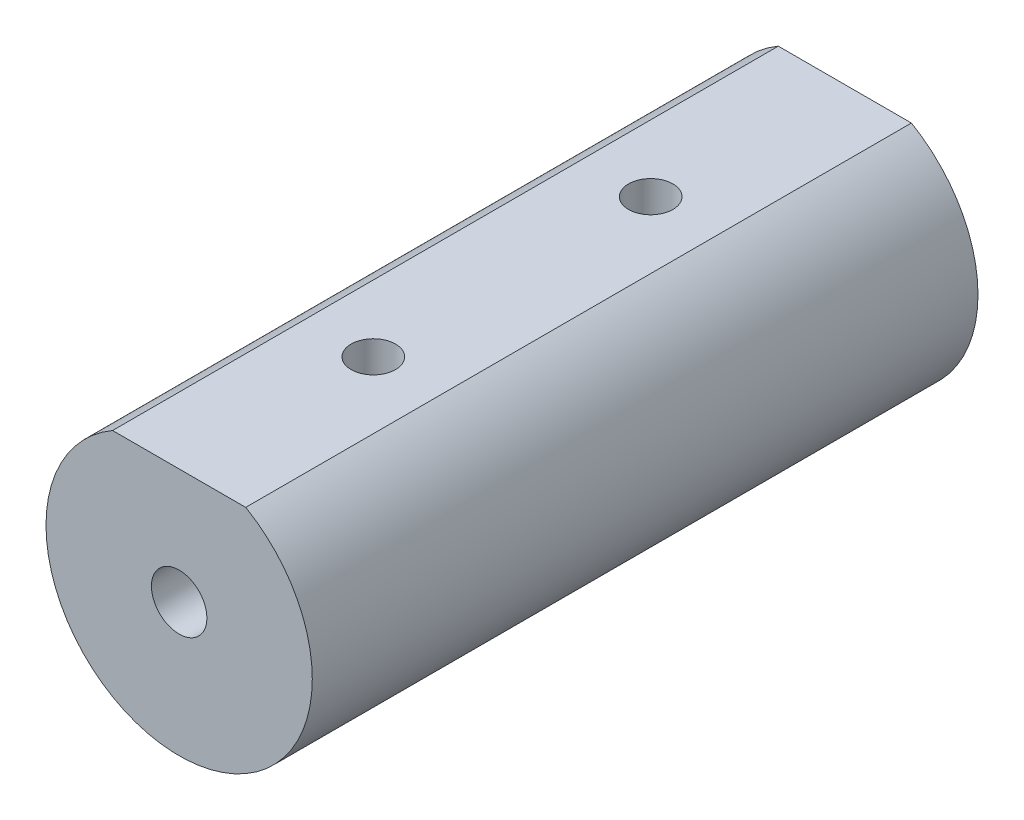
from build123d import *

# Parameters (mm, degrees)
SKETCH1_W          = 60
SKETCH1_H          = 9.5
CUT_EXTRUDE1_REACH = 64.354
CUT_EXTRUDE2_REACH = 67.157
SKETCH3_R          = 2


with BuildPart() as part:
    # Sketch1 → Revolve1 (revolve)
    with BuildSketch(Plane(origin=(0, 0, 0), x_dir=(0, 0, -1), z_dir=(1, 0, 0))):
        with Locations((30, 7.25)):
            Rectangle(SKETCH1_W, SKETCH1_H)
    revolve(axis=Axis((0, 0, 0), (0, 0, -1)))

    # Sketch2 → Cut-Extrude1 (cut, up to next)
    with BuildSketch(Plane(origin=(0, 0, -60), x_dir=(-1, 0, 0), z_dir=(0, 0, -1)), mode=Mode.PRIVATE) as cut_extrude1_sk1:
        with BuildLine():
            Line((6, 10.392304845), (-6, 10.392304845))
            ThreePointArc((-6, 10.392304845), (0, 12), (6, 10.392304845))
        make_face()
    cut_extrude1_tool1 = extrude(cut_extrude1_sk1.sketch, amount=-CUT_EXTRUDE1_REACH, mode=Mode.PRIVATE) & part.part
    add(cut_extrude1_tool1.solids().sort_by_distance((0, 11.039224, -60))[0], mode=Mode.SUBTRACT)

    # Sketch3 → Cut-Extrude2 (cut, up to next)
    with BuildSketch(Plane(origin=(0, 10.392304845, 0), x_dir=(1, 0, 0), z_dir=(0, 1, 0)), mode=Mode.PRIVATE) as cut_extrude2_sk1:
        with Locations((0, 42.5)):
            Circle(SKETCH3_R)
    cut_extrude2_tool1 = extrude(cut_extrude2_sk1.sketch, amount=-CUT_EXTRUDE2_REACH, mode=Mode.PRIVATE) & part.part
    # Sketch3 → Cut-Extrude2 (cut, up to next)
    with BuildSketch(Plane(origin=(0, 10.392304845, 0), x_dir=(1, 0, 0), z_dir=(0, 1, 0)), mode=Mode.PRIVATE) as cut_extrude2_sk2:
        with Locations((0, 17.5)):
            Circle(SKETCH3_R)
    cut_extrude2_tool2 = extrude(cut_extrude2_sk2.sketch, amount=-CUT_EXTRUDE2_REACH, mode=Mode.PRIVATE) & part.part
    add(cut_extrude2_tool1.solids().sort_by_distance((0, 10.392305, -42.5))[0], mode=Mode.SUBTRACT)
    add(cut_extrude2_tool2.solids().sort_by_distance((0, 10.392305, -17.5))[0], mode=Mode.SUBTRACT)


solid = part.part
